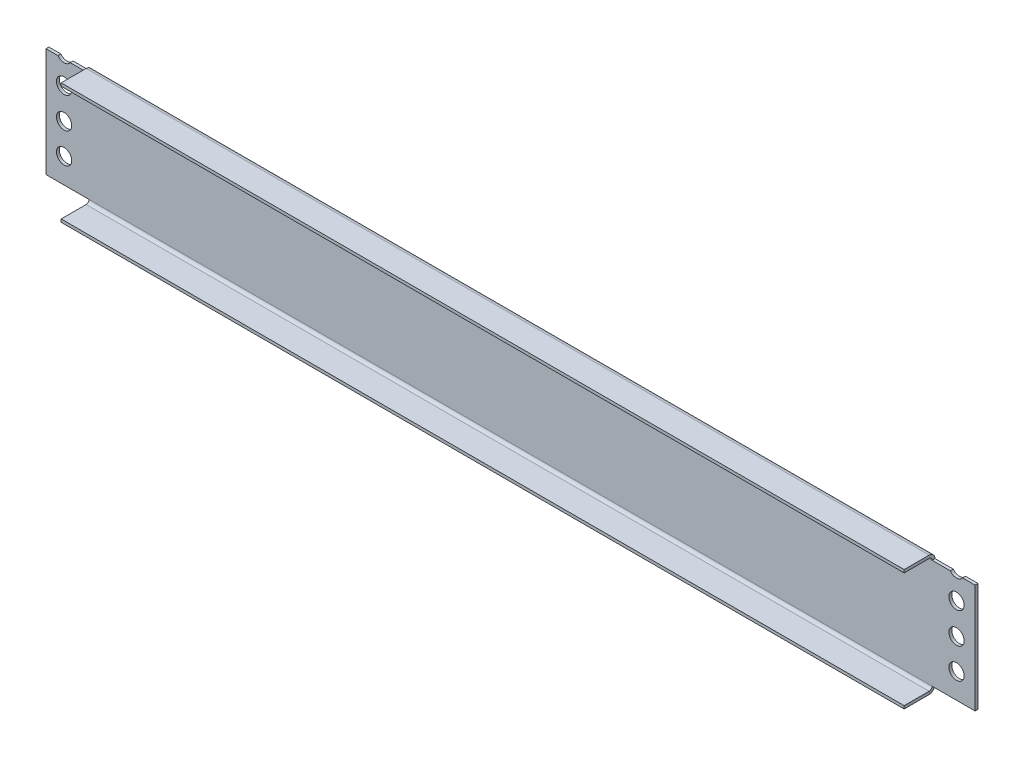
from build123d import *

# Parameters (mm, degrees)
CROQUIS1_W                         = 482.6
CROQUIS1_H                         = 62.738
BRIDA_BASE1_DEPTH                  = 1.524
BRIDA_DE_ARISTA1_STRIP_W           = 9.144
BRIDA_DE_ARISTA1_STRIP_H           = 1.524
BRIDA_DE_ARISTA1_STRIP_CUT_DEPTH   = 482.6
BRIDA_DE_ARISTA1_STRIP_2_W         = 9.144
BRIDA_DE_ARISTA1_STRIP_2_H         = 1.524
BRIDA_DE_ARISTA1_STRIP_CUT_2_DEPTH = 482.6
BRIDA_DE_ARISTA1_DEPTH             = 482.6
BRIDA_DE_ARISTA1_BEND_DEPTH        = 482.6
CROQUIS12_R                        = 3.9624
CORTAR_EXTRUIR1_DEPTH              = 58.166
CORTAR_EXTRUIR2_DEPTH              = 1.016
CORTAR_EXTRUIR2_DEPTH_BACK         = 3.048
CROQUIS13_W                        = 22.352
CROQUIS13_H                        = 16.002
CROQUIS14_W                        = 22.352
CROQUIS14_H                        = 16.002
CORTAR_EXTRUIR3_DEPTH              = 3.048
CROQUIS15_R                        = 3.937
CORTAR_EXTRUIR4_DEPTH              = 2.794


# Sheet-metal steps are written as plain solids
with BuildPart() as part:
    # Croquis1 → Brida base1 (new body)
    with BuildSketch(Plane.XY):
        Rectangle(CROQUIS1_W, CROQUIS1_H)
    extrude(amount=-BRIDA_BASE1_DEPTH)

    # Brida de arista1 strip (across the edge) → Brida de arista1 strip cut (cut)
    with BuildSketch(Plane(origin=(241.3, 31.369, 0), x_dir=(0, -1, 0), z_dir=(-1, 0, 0))):
        with Locations((-1.524, -0.762)):
            Rectangle(BRIDA_DE_ARISTA1_STRIP_W, BRIDA_DE_ARISTA1_STRIP_H)
    extrude(amount=BRIDA_DE_ARISTA1_STRIP_CUT_DEPTH, mode=Mode.SUBTRACT)

    # Brida de arista1 strip 2 (across the edge) → Brida de arista1 strip cut 2 (cut)
    with BuildSketch(Plane(origin=(-241.3, -31.369, 0), x_dir=(0, 1, 0), z_dir=(1, 0, 0))):
        with Locations((-1.524, -0.762)):
            Rectangle(BRIDA_DE_ARISTA1_STRIP_2_W, BRIDA_DE_ARISTA1_STRIP_2_H)
    extrude(amount=BRIDA_DE_ARISTA1_STRIP_CUT_2_DEPTH, mode=Mode.SUBTRACT)

    # Brida de arista1 section (across the edge) → Brida de arista1 (add)
    with BuildSketch(Plane(origin=(241.3, 31.369, 0), x_dir=(0, -1, 0), z_dir=(-1, 0, 0))):
        with BuildLine():
            Line((0, 1.524), (0, 14.478))
            Line((0, 14.478), (1.524, 14.478))
            Line((1.524, 14.478), (1.524, 1.524))
            ThreePointArc((1.524, 1.524), (1.970369265, 0.446369265), (3.048, 0))
            Line((3.048, 0), (3.048, -1.524))
            ThreePointArc((3.048, -1.524), (0.892738531, -0.631261469), (0, 1.524))
        make_face()
    extrude(amount=BRIDA_DE_ARISTA1_DEPTH)

    # Brida de arista1 section 2 (across the edge) → Brida de arista1 bend (add)
    with BuildSketch(Plane(origin=(-241.3, -31.369, 0), x_dir=(0, 1, 0), z_dir=(1, 0, 0))):
        with BuildLine():
            Line((0, 1.524), (0, 14.478))
            Line((0, 14.478), (1.524, 14.478))
            Line((1.524, 14.478), (1.524, 1.524))
            ThreePointArc((1.524, 1.524), (1.970369265, 0.446369265), (3.048, 0))
            Line((3.048, 0), (3.048, -1.524))
            ThreePointArc((3.048, -1.524), (0.892738531, -0.631261469), (0, 1.524))
        make_face()
    extrude(amount=BRIDA_DE_ARISTA1_BEND_DEPTH)

    # Croquis12 → Cortar-Extruir1 (cut)
    with BuildSketch(Plane.XY):
        with Locations((231.648, 16.383)):
            Circle(CROQUIS12_R)
        with Locations((231.648, 0.381)):
            Circle(CROQUIS12_R)
        with Locations((231.648, -15.367)):
            Circle(CROQUIS12_R)
        with Locations((-231.902, 16.383)):
            Circle(CROQUIS12_R)
        with Locations((-231.902, 0.381)):
            Circle(CROQUIS12_R)
        with Locations((-231.902, -15.367)):
            Circle(CROQUIS12_R)
    extrude(amount=-CORTAR_EXTRUIR1_DEPTH, mode=Mode.SUBTRACT)

    # Croquis13 → Cortar-Extruir2 (cut, two sides: drawn at the far end of the back side and taken through both)
    with BuildSketch(Plane(origin=(0, 31.369, 0), x_dir=(1, 0, 0), z_dir=(0, 1, 0)).offset(-CORTAR_EXTRUIR2_DEPTH_BACK)):
        with Locations((230.124, -6.477)):
            Rectangle(CROQUIS13_W, CROQUIS13_H)
        with Locations((-230.124, -6.477)):
            Rectangle(CROQUIS13_W, CROQUIS13_H)
    extrude(amount=CORTAR_EXTRUIR2_DEPTH + CORTAR_EXTRUIR2_DEPTH_BACK, mode=Mode.SUBTRACT)

    # Croquis14 → Cortar-Extruir3 (cut)
    with BuildSketch(Plane.XZ.offset(31.369)):
        with Locations((-230.124, 6.477)):
            Rectangle(CROQUIS14_W, CROQUIS14_H)
        with Locations((230.124, 6.477)):
            Rectangle(CROQUIS14_W, CROQUIS14_H)
    extrude(amount=-CORTAR_EXTRUIR3_DEPTH, mode=Mode.SUBTRACT)

    # Croquis15 → Cortar-Extruir4 (cut)
    with BuildSketch(Plane.XY):
        with Locations((-231.902, 30.6324)):
            Circle(CROQUIS15_R)
        with Locations((231.648, 30.6324)):
            Circle(CROQUIS15_R)
    extrude(amount=-CORTAR_EXTRUIR4_DEPTH, mode=Mode.SUBTRACT)


solid = part.part
